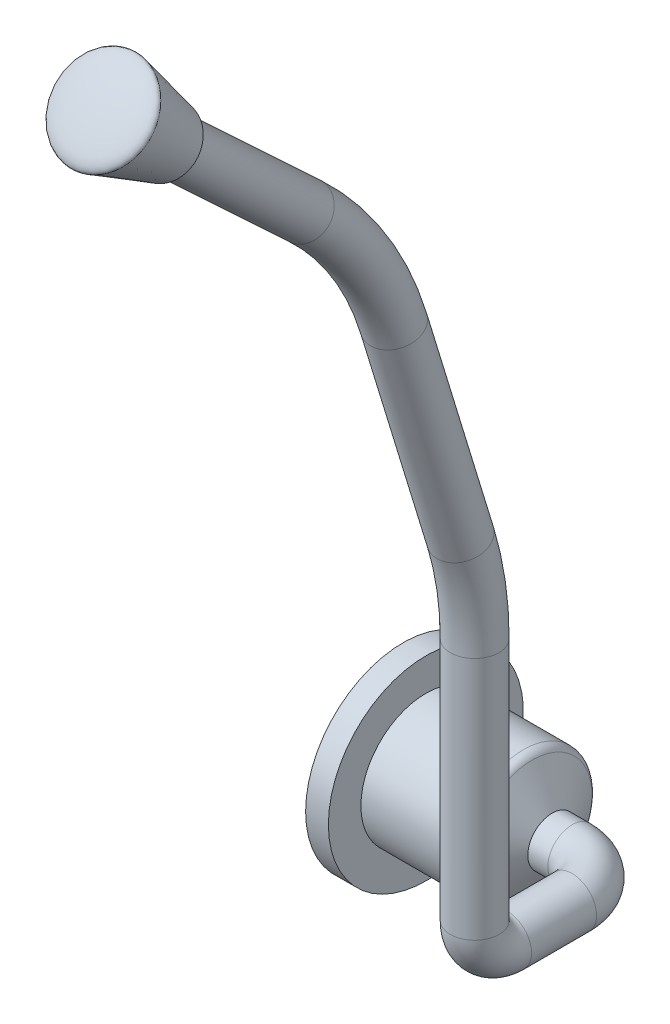
from build123d import *

# Parameters (mm, degrees)
SKETCH2_R          = 7.5
SWEEP2_START       = -58
SWEEP2_OUTLINE_R   = 7.5
SWEEP2_DEPTH       = 45
SWEEP2_2_OUTLINE_R = 7.5
SWEEP2_2_ANGLE     = 90


with BuildPart() as part:
    # Sweep1: sweep along a path in Sketch1
    with BuildLine(Plane(origin=(0, 0, 0), x_dir=(0, 0, -1), z_dir=(1, 0, 0))) as sweep1_path:
        Line((-125, 265), (-82.266183324, 225.150071262))
        ThreePointArc((-82.266183324, 225.150071262), (-65.661209715, 205.006627523), (-54.835543734, 181.251871572))
        Line((-54.835543734, 181.251871572), (-34.369524404, 114.310538655))
        ThreePointArc((-34.369524404, 114.310538655), (-31.098413664, 99.854309295), (-30, 85.073368182))
        Line((-30, 85.073368182), (-30, 10))
        ThreePointArc((-30, 10), (-27.071067812, 2.928932188), (-20, 0))
        Line((-20, 0), (0, 0))
    # Sketch2 → Sweep1 (sweep)
    with BuildSketch(Plane.XY):
        Circle(SKETCH2_R)
    sweep(path=sweep1_path.line)

    # Sketch3 → Revolve1 (revolve)
    with BuildSketch(Plane(origin=(0, 0, 0), x_dir=(0, 0, -1), z_dir=(1, 0, 0))):
        with BuildLine():
            Line((-146.940611049, 285.459950802), (-125, 265))
            Line((-125, 265), (-118.521015579, 271.947860165))
            Line((-118.521015579, 271.947860165), (-133.977346338, 293.118807582))
            Line((-133.977346338, 293.118807582), (-134.213781062, 293.442658514))
            add(Edge.make_bspline(
                [(-134.213781062, 293.442658514), (-137.039454328, 296.077641462), (-146.940611049, 285.459950802)],
                knots=[3.152090242, 3.152090242, 3.152090242, 4.71238898, 4.71238898, 4.71238898], degree=2, weights=[0.958581046, 0.692308113, 1]))
        make_face()
    revolve(axis=Axis((0, 265, 125), (0, 0.6819983600624947, 0.731353701619174)))



with BuildPart() as body_2:
    # Sweep2: read off the stored shape, not the designer's step
    # Sweep2 outline → Sweep2 (new body)
    with BuildSketch(Plane.YZ.offset(SWEEP2_START)):
        with Locations((0, -13)):
            Circle(SWEEP2_OUTLINE_R)
    extrude(amount=SWEEP2_DEPTH)


with BuildPart() as part_1:
    add(part.part)

    add(body_2.part)  # Sweep2 2 merges body 2
    # Sweep2 2 outline → Sweep2 2 (revolve)
    with BuildSketch(Plane(origin=(-13, 0, 0), x_dir=(1, 0, 0), z_dir=(0, 0, 1))):
        with Locations((13, 0)):
            Circle(SWEEP2_2_OUTLINE_R)
    revolve(axis=Axis((-13, 0, 0), (0, 1, 0)), revolution_arc=SWEEP2_2_ANGLE)

    # Sketch6 → Revolve2 (revolve)
    with BuildSketch(Plane(origin=(0, 0, 0), x_dir=(1, 0, 0), z_dir=(0, 1, 0)), mode=Mode.PRIVATE) as revolve2_sk:
        with BuildLine():
            Line((-58, 33), (-58, 13))
            Line((-58, 13), (-25, 13))
            Line((-25, 13), (-25, 20.5))
            Line((-25, 20.5), (-19.159518744, 20.5))
            Line((-19.159518744, 20.5), (-25.39084721, 31.480649088))
            ThreePointArc((-25.39084721, 31.480649088), (-26.490355549, 32.592484066), (-28, 33))
            Line((-28, 33), (-58, 33))
        make_face()
        Polygon((-65, 13), (-58, 13), (-58, 33), (-58, 43), (-65, 43), align=None)
    revolve(revolve2_sk.sketch.rotate(Axis((-58, 0, -13), (1, 0, 0)), 180), axis=Axis((-58, 0, -13), (1, 0, 0)))


solid = part_1.part
